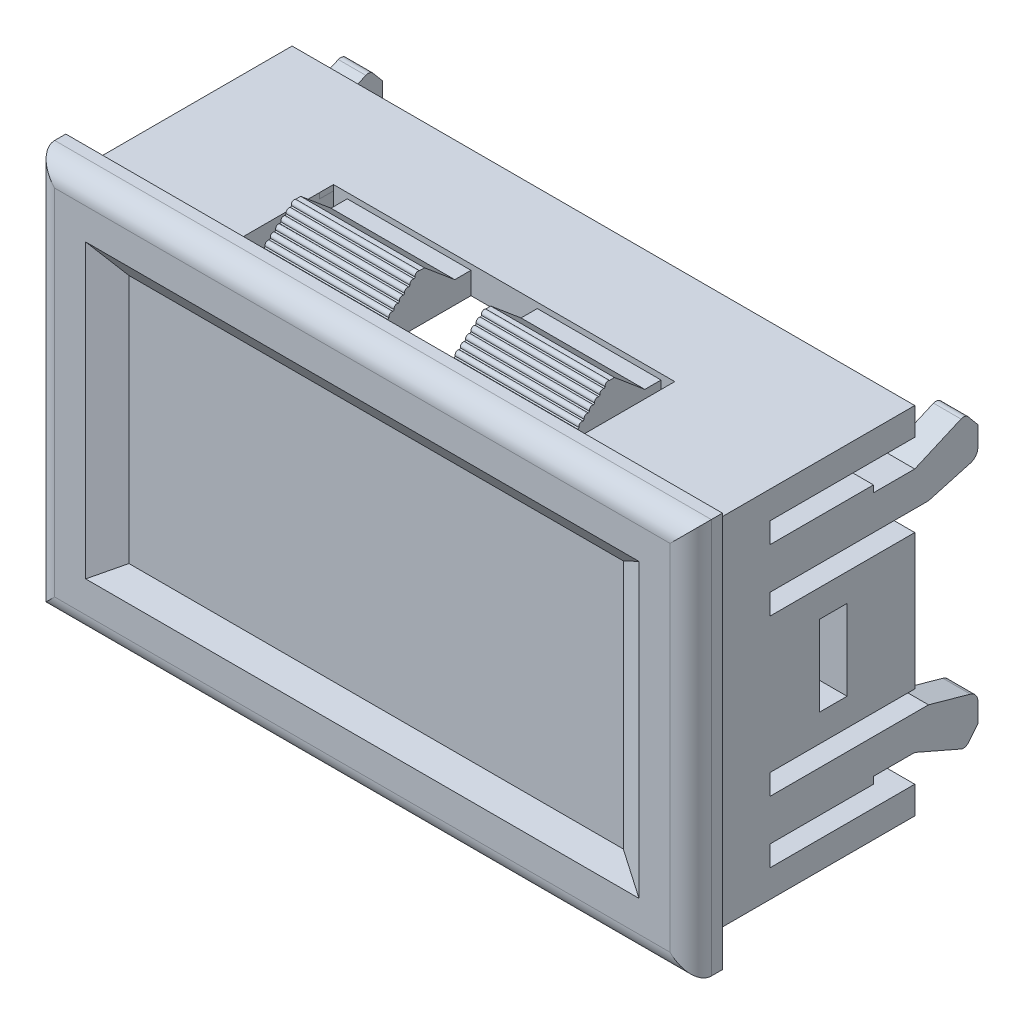
from build123d import *
from OCP.BRepFilletAPI import BRepFilletAPI_MakeChamfer

# Parameters (mm, degrees)
ESBO_O1_W                   = 47.75
ESBO_O1_H                   = 28.75
RESSALTO_EXTRUS_O1_DEPTH    = 17.53
ESBO_O3_W                   = 55.113346814
ESBO_O3_H                   = 32.23245858
ESBO_O3_W_2                 = 45.28
ESBO_O3_H_2                 = 25.85
CORTE_EXTRUS_O1_DEPTH       = 15.22
CORTE_EXTRUS_O2_DEPTH       = 17
CORTE_EXTRUS_O2_DEPTH_BACK  = 33.22
ESBO_O4_W                   = 35.95
ESBO_O4_H                   = 18.14
ESBO_O5_W                   = 41.28
ESBO_O5_H                   = 21.85
CORTE_EXTRUS_O3_DEPTH       = 15.22
CHANFRO1_SIZE               = 1
CHANFRO1_SIZE2              = 2.144506921
CHANFRO2_SIZE               = 1
CHANFRO2_SIZE2              = 2.144506921
CHANFRO3_SIZE               = 1
CHANFRO3_SIZE2              = 1.539864964
FILETE1_R                   = 1.5
CORTE_EXTRUS_O4_DEPTH       = 15
CORTE_EXTRUS_O4_DEPTH_BACK  = 44.22
CORTE_EXTRUS_O5_DEPTH       = 0.4
ESBO_O8_W                   = 24.82
ESBO_O8_H                   = 1
CORTE_EXTRUS_O6_DEPTH       = 0.4
ESBO_O9_W                   = 9
ESBO_O9_H                   = 6.324480946
RESSALTO_EXTRUS_O2_DEPTH    = 1.45
ESBO_O10_W                  = 9
ESBO_O10_H                  = 6.324480946
RESSALTO_EXTRUS_O3_DEPTH    = 1.45
ESBO_O11_W                  = 9
ESBO_O11_H                  = 6.324480946
RESSALTO_EXTRUS_O4_DEPTH    = 1.45
CHANFRO4_SIZE               = 3
CHANFRO4_SIZE2              = 3.575260778
RESSALTO_EXTRUS_O5_DEPTH    = 22.82
CORTE_EXTRUS_O9_DEPTH       = 16
CORTE_EXTRUS_O9_DEPTH_BACK  = 35.82
ESBO_O15_W                  = 4.82
ESBO_O15_H                  = 3.575260778
CORTE_EXTRUS_O10_DEPTH      = 22.82
RESSALTO_EXTRUS_O6_DEPTH    = 9
RESSALTO_EXTRUS_O8_DEPTH    = 9
RESSALTO_EXTRUS_O9_DEPTH    = 22.82
ESBO_O21_W                  = 4.82
ESBO_O21_H                  = 3.736219412
CORTE_EXTRUS_O11_DEPTH      = 22.82
CORTE_EXTRUS_O13_DEPTH      = 20
CORTE_EXTRUS_O13_DEPTH_BACK = 22.82
ESBO_O22_W                  = 4.82
ESBO_O22_H                  = 3.575260778
ESBO_O23_W                  = 2
ESBO_O23_H                  = 5.85
ESBO_O23_W_2                = 10.53
ESBO_O23_H_2                = 1.5
CORTE_EXTRUS_O14_DEPTH      = 62.82
ESBO_O24_W                  = 3
ESBO_O24_H                  = 0.495952345
ESBO_O24_H_2                = 0.5
CORTE_EXTRUS_O15_DEPTH      = 62.82
RESSALTO_EXTRUS_O10_DEPTH   = 45.28
ESBO_O26_W                  = 41.28
ESBO_O26_H                  = 21.85
CORTE_EXTRUS_O16_DEPTH      = 41.28
SKETCH1_W                   = 1.31
SKETCH1_H                   = 18.14
BOSS_EXTRUDE1_DEPTH         = 35.95


with BuildPart() as part:
    # Esboço1 → Ressalto-extrusão1 (new body)
    with BuildSketch(Plane.XY):
        Rectangle(ESBO_O1_W, ESBO_O1_H)
    extrude(amount=RESSALTO_EXTRUS_O1_DEPTH)

    # Esboço3 → Corte-extrusão1 (cut)
    with BuildSketch(Plane(origin=(0, 0, 0), x_dir=(-1, 0, 0), z_dir=(0, 0, -1))):
        Rectangle(ESBO_O3_W, ESBO_O3_H)
        Rectangle(ESBO_O3_W_2, ESBO_O3_H_2, mode=Mode.SUBTRACT)
    extrude(amount=-CORTE_EXTRUS_O1_DEPTH, mode=Mode.SUBTRACT)

    # Esboço4 → Corte-extrusão2 (cut, two sides: drawn at the far end of the back side and taken through both)
    with BuildSketch(Plane.XY.offset(17.53).offset(-CORTE_EXTRUS_O2_DEPTH_BACK)):
        Rectangle(ESBO_O4_W, ESBO_O4_H)
    extrude(amount=CORTE_EXTRUS_O2_DEPTH + CORTE_EXTRUS_O2_DEPTH_BACK, mode=Mode.SUBTRACT)

    # Esboço5 → Corte-extrusão3 (cut)
    with BuildSketch(Plane(origin=(0, 0, 0), x_dir=(-1, 0, 0), z_dir=(0, 0, -1))):
        Rectangle(ESBO_O5_W, ESBO_O5_H)
    extrude(amount=-CORTE_EXTRUS_O3_DEPTH, mode=Mode.SUBTRACT)

    # Chanfro1
    chanfro1_edges = [part.edges().sort_by_distance(p)[0] for p in [
        (17.975, 0, 17.53),
    ]]
    chanfro1_side = [part.faces().sort_by_distance(p)[0] for p in [
        (17.975, 0, 16.375),
    ]]
    chamfer(chanfro1_edges, length=CHANFRO1_SIZE, length2=CHANFRO1_SIZE2, reference=chanfro1_side[0])

    # Chanfro2
    chanfro2_edges = [part.edges().sort_by_distance(p)[0] for p in [
        (-17.975, 0, 17.53),
    ]]
    chanfro2_side = [part.faces().sort_by_distance(p)[0] for p in [
        (-17.975, 0, 16.375),
    ]]
    chamfer(chanfro2_edges, length=CHANFRO2_SIZE, length2=CHANFRO2_SIZE2, reference=chanfro2_side[0])

    # Chanfro3: one chamfer whose edges measure the first distance from different faces: ONE call of the kernel's chamfer builder (chamfer() names one face for all edges)
    chanfro3_edges_1 = [part.edges().sort_by_distance(p)[0] for p in [
        (0, -9.07, 17.53),
    ]]
    chanfro3_side_1 = [part.faces().sort_by_distance(p)[0] for p in [
        (0, -9.07, 16.39568424),
    ]]
    chanfro3_edges_2 = [part.edges().sort_by_distance(p)[0] for p in [
        (0, 9.07, 17.53),
    ]]
    chanfro3_side_2 = [part.faces().sort_by_distance(p)[0] for p in [
        (0, 9.07, 16.39568424),
    ]]
    chanfro3 = BRepFilletAPI_MakeChamfer(part.part.solid().wrapped)
    for e in chanfro3_edges_1:
        chanfro3.Add(CHANFRO3_SIZE, CHANFRO3_SIZE2, e.wrapped, chanfro3_side_1[0].wrapped)  # the first distance lies on this face
    for e in chanfro3_edges_2:
        chanfro3.Add(CHANFRO3_SIZE, CHANFRO3_SIZE2, e.wrapped, chanfro3_side_2[0].wrapped)  # the first distance lies on this face
    add(Compound.cast(chanfro3.Shape()), mode=Mode.REPLACE)

    # Filete1
    filete1_edges = [part.edges().sort_by_distance(p)[0] for p in [
        (23.875, 0, 17.53),
        (0, 14.375, 17.53),
        (-23.875, 0, 17.53),
        (0, -14.375, 17.53),
    ]]
    fillet(filete1_edges, radius=FILETE1_R)

    # Esboço6 → Corte-extrusão4 (cut, two sides: drawn at the far end of the back side and taken through both)
    with BuildSketch(Plane(origin=(0, 12.925, 0), x_dir=(1, 0, 0), z_dir=(0, 1, 0)).offset(-CORTE_EXTRUS_O4_DEPTH_BACK)):
        Polygon((-11.41, -7.895519054), (-11.41, -7.22), (-12.41, -7.22), (-12.41, -15.22), (12.41, -15.22), (12.41, -7.22), (11.41, -7.22), (11.41, -7.895519054), (11.41, -14.544480946), (2.41, -14.544480946), (2.41, -7.22), (-2.41, -7.22), (-2.41, -14.544480946), (-11.41, -14.544480946), align=None)
    extrude(amount=CORTE_EXTRUS_O4_DEPTH + CORTE_EXTRUS_O4_DEPTH_BACK, mode=Mode.SUBTRACT)

    # Esboço7 → Corte-extrusão5 (cut)
    with BuildSketch(Plane(origin=(0, 12.925, 0), x_dir=(1, 0, 0), z_dir=(0, 1, 0))):
        Polygon((-12.410087555, -8.22), (12.410087555, -8.22), (12.41, -7.22), (-12.41, -7.22), align=None)
    extrude(amount=-CORTE_EXTRUS_O5_DEPTH, mode=Mode.SUBTRACT)

    # Esboço8 → Corte-extrusão6 (cut)
    with BuildSketch(Plane.XZ.offset(12.925)):
        with Locations((0, 7.72)):
            Rectangle(ESBO_O8_W, ESBO_O8_H)
    extrude(amount=-CORTE_EXTRUS_O6_DEPTH, mode=Mode.SUBTRACT)

    # Esboço9 → Ressalto-extrusão2 (add)
    with BuildSketch(Plane(origin=(0, 12.925, 0), x_dir=(1, 0, 0), z_dir=(0, 1, 0))):
        with Locations((-6.91, -11.382240473)):
            Rectangle(ESBO_O9_W, ESBO_O9_H)
    extrude(amount=RESSALTO_EXTRUS_O2_DEPTH)

    # Esboço10 → Ressalto-extrusão3 (add)
    with BuildSketch(Plane(origin=(0, 12.925, 0), x_dir=(1, 0, 0), z_dir=(0, 1, 0))):
        with Locations((6.91, -11.382240473)):
            Rectangle(ESBO_O10_W, ESBO_O10_H)
    extrude(amount=RESSALTO_EXTRUS_O3_DEPTH)

    # Esboço11 → Ressalto-extrusão4 (add)
    with BuildSketch(Plane.XZ.offset(12.925)):
        with Locations((6.91, 11.382240473)):
            Rectangle(ESBO_O11_W, ESBO_O11_H)
        Polygon((-2.41, 8.22), (-2.41, 14.544480946), (-6.91, 14.544480946), (-11.41, 14.544480946), (-11.41, 8.22), align=None)
    extrude(amount=RESSALTO_EXTRUS_O4_DEPTH)

    # Chanfro4: one chamfer whose edges measure the first distance from different faces: ONE call of the kernel's chamfer builder (chamfer() names one face for all edges)
    chanfro4_edges_1 = [part.edges().sort_by_distance(p)[0] for p in [
        (-6.91, 14.375, 14.544480946),
    ]]
    chanfro4_side_1 = [part.faces().sort_by_distance(p)[0] for p in [
        (-6.91, 12.65, 14.544480946),
    ]]
    chanfro4_edges_2 = [part.edges().sort_by_distance(p)[0] for p in [
        (6.91, 14.375, 14.544480946),
    ]]
    chanfro4_side_2 = [part.faces().sort_by_distance(p)[0] for p in [
        (6.91, 12.65, 14.544480946),
    ]]
    chanfro4_edges_3 = [part.edges().sort_by_distance(p)[0] for p in [
        (6.91, -14.375, 14.544480946),
    ]]
    chanfro4_side_3 = [part.faces().sort_by_distance(p)[0] for p in [
        (6.91, -12.65, 14.544480946),
    ]]
    chanfro4_edges_4 = [part.edges().sort_by_distance(p)[0] for p in [
        (-6.91, -14.375, 14.544480946),
    ]]
    chanfro4_side_4 = [part.faces().sort_by_distance(p)[0] for p in [
        (-6.91, -12.65, 14.544480946),
    ]]
    chanfro4 = BRepFilletAPI_MakeChamfer(part.part.solid().wrapped)
    for e in chanfro4_edges_1:
        chanfro4.Add(CHANFRO4_SIZE, CHANFRO4_SIZE2, e.wrapped, chanfro4_side_1[0].wrapped)  # the first distance lies on this face
    for e in chanfro4_edges_2:
        chanfro4.Add(CHANFRO4_SIZE, CHANFRO4_SIZE2, e.wrapped, chanfro4_side_2[0].wrapped)  # the first distance lies on this face
    for e in chanfro4_edges_3:
        chanfro4.Add(CHANFRO4_SIZE, CHANFRO4_SIZE2, e.wrapped, chanfro4_side_3[0].wrapped)  # the first distance lies on this face
    for e in chanfro4_edges_4:
        chanfro4.Add(CHANFRO4_SIZE, CHANFRO4_SIZE2, e.wrapped, chanfro4_side_4[0].wrapped)  # the first distance lies on this face
    add(Compound.cast(chanfro4.Shape()), mode=Mode.REPLACE)

    # Chanfro5
    # the kernel refuses this chamfer: 2.383507185, 2 mm, written as the material it takes off along each edge
    with BuildSketch(Plane(origin=(-11.41, 14.375, 8.22), x_dir=(0, 0.024939322090234445, 0.9996889667359941), z_dir=(1, 0, 0))) as chanfro5_piece_1_section:
        with BuildLine():
            Line((2.457306387, 0), (-0.124419196, 2.058820987))
            Line((-0.124419196, 2.058820987), (-0.172074512, 2.057632126))
            ThreePointArc((-0.172074512, 2.057632126), (-0.073358824, 1.029132353), (-0.047655317, -0.001188861))
            Line((-0.047655317, -0.001188861), (0.001188861, -0.047655317))
            ThreePointArc((0.001188861, -0.047655317), (1.229077869, -0.01702307), (2.458495248, -0.047655317))
            Line((2.458495248, -0.047655317), (2.457306387, 0))
        make_face()
    chanfro5_piece_1 = extrude(amount=9, mode=Mode.PRIVATE)
    chanfro5_piece_1 = split(chanfro5_piece_1, bisect_by=Plane(origin=(-6.91, 12.525, 9.020332746), z_dir=(0, 1, 0)), keep=Keep.TOP, mode=Mode.PRIVATE)
    add(chanfro5_piece_1, mode=Mode.SUBTRACT)
    with BuildSketch(Plane(origin=(11.41, 14.375, 8.22), x_dir=(0, 0.024939322090234445, 0.9996889667359941), z_dir=(-1, 0, 0))) as chanfro5_piece_2_section:
        with BuildLine():
            Line((2.457306387, 0), (-0.124419196, -2.058820987))
            Line((-0.124419196, -2.058820987), (-0.172074512, -2.057632126))
            ThreePointArc((-0.172074512, -2.057632126), (-0.073358824, -1.029132353), (-0.047655317, 0.001188861))
            Line((-0.047655317, 0.001188861), (0.001188861, 0.047655317))
            ThreePointArc((0.001188861, 0.047655317), (1.229077869, 0.01702307), (2.458495248, 0.047655317))
            Line((2.458495248, 0.047655317), (2.457306387, 0))
        make_face()
    chanfro5_piece_2 = extrude(amount=9, mode=Mode.PRIVATE)
    chanfro5_piece_2 = split(chanfro5_piece_2, bisect_by=Plane(origin=(6.91, 12.525, 9.020332746), z_dir=(0, 1, 0)), keep=Keep.TOP, mode=Mode.PRIVATE)
    add(chanfro5_piece_2, mode=Mode.SUBTRACT)
    with BuildSketch(Plane(origin=(2.41, -14.375, 8.22), x_dir=(0, -0.024939322090234445, 0.9996889667359941), z_dir=(1, 0, 0))) as chanfro5_piece_3_section:
        with BuildLine():
            Line((2.457306387, 0), (-0.124419196, -2.058820987))
            Line((-0.124419196, -2.058820987), (-0.172074512, -2.057632126))
            ThreePointArc((-0.172074512, -2.057632126), (-0.073358824, -1.029132353), (-0.047655317, 0.001188861))
            Line((-0.047655317, 0.001188861), (0.001188861, 0.047655317))
            ThreePointArc((0.001188861, 0.047655317), (1.229077869, 0.01702307), (2.458495248, 0.047655317))
            Line((2.458495248, 0.047655317), (2.457306387, 0))
        make_face()
    chanfro5_piece_3 = extrude(amount=9, mode=Mode.PRIVATE)
    chanfro5_piece_3 = split(chanfro5_piece_3, bisect_by=Plane(origin=(6.91, -12.525, 9.020332746), z_dir=(0, -1, 0)), keep=Keep.TOP, mode=Mode.PRIVATE)
    add(chanfro5_piece_3, mode=Mode.SUBTRACT)
    with BuildSketch(Plane(origin=(-11.41, -14.375, 8.22), x_dir=(0, -0.03540953691366296, 0.9993728857116145), z_dir=(1, 0, 0))) as chanfro5_piece_4_section:
        with BuildLine():
            Line((2.062577027, 0), (-0.148230141, -2.452831528))
            Line((-0.148230141, -2.452831528), (-0.19587039, -2.45114355))
            ThreePointArc((-0.19587039, -2.45114355), (-0.091132758, -1.225812797), (-0.047640249, 0.001687978))
            Line((-0.047640249, 0.001687978), (0.001687978, 0.047640249))
            ThreePointArc((0.001687978, 0.047640249), (1.031683425, 0.011145701), (2.064265005, 0.047640249))
            Line((2.064265005, 0.047640249), (2.062577027, 0))
        make_face()
    chanfro5_piece_4 = extrude(amount=9, mode=Mode.PRIVATE)
    chanfro5_piece_4 = split(chanfro5_piece_4, bisect_by=Plane(origin=(-6.91, -12.525, 8.913974099), z_dir=(0, -1, 0)), keep=Keep.TOP, mode=Mode.PRIVATE)
    add(chanfro5_piece_4, mode=Mode.SUBTRACT)

    # Esboço13 → Ressalto-extrusão5 (add)
    with BuildSketch(Plane.ZY.offset(11.41)):
        with BuildLine():
            Line((11.273544974, 14.119641167), (10.969220168, 14.375))
            ThreePointArc((10.969220168, 14.375), (11.208122757, 14.350693512), (11.273544974, 14.119641167))
        make_face()
        with BuildLine():
            Line((11.352242389, 14.053606195), (11.656567196, 13.798247362))
            ThreePointArc((11.656567196, 13.798247362), (11.591144979, 14.029299707), (11.352242389, 14.053606195))
        make_face()
        with BuildLine():
            Line((11.735264611, 13.73221239), (12.039589418, 13.476853557))
            ThreePointArc((12.039589418, 13.476853557), (11.974167201, 13.707905902), (11.735264611, 13.73221239))
        make_face()
        with BuildLine():
            Line((12.118286833, 13.410818585), (12.422611639, 13.155459753))
            ThreePointArc((12.422611639, 13.155459753), (12.357189422, 13.386512098), (12.118286833, 13.410818585))
        make_face()
        with BuildLine():
            Line((12.501309054, 13.089424781), (12.805633861, 12.834065948))
            ThreePointArc((12.805633861, 12.834065948), (12.740211644, 13.065118293), (12.501309054, 13.089424781))
        make_face()
        with BuildLine():
            Line((12.884331276, 12.768030976), (13.188656082, 12.512672143))
            ThreePointArc((13.188656082, 12.512672143), (13.123233865, 12.743724488), (12.884331276, 12.768030976))
        make_face()
        with BuildLine():
            Line((13.267353497, 12.446637171), (13.571678304, 12.191278338))
            ThreePointArc((13.571678304, 12.191278338), (13.506256087, 12.422330683), (13.267353497, 12.446637171))
        make_face()
        with BuildLine():
            Line((13.650375719, 12.125243366), (13.954700525, 11.869884533))
            ThreePointArc((13.954700525, 11.869884533), (13.889278308, 12.100936878), (13.650375719, 12.125243366))
        make_face()
        with BuildLine():
            Line((14.03339794, 11.803849561), (14.337722747, 11.548490728))
            ThreePointArc((14.337722747, 11.548490728), (14.27230053, 11.779543073), (14.03339794, 11.803849561))
        make_face()
    extrude(amount=-RESSALTO_EXTRUS_O5_DEPTH)

    # Esboço15 → Corte-extrusão9 (cut, two sides: drawn at the far end of the back side and taken through both)
    with BuildSketch(Plane.XZ.offset(12.925).offset(-CORTE_EXTRUS_O9_DEPTH_BACK)):
        with Locations((0, 12.756850557)):
            Rectangle(ESBO_O15_W, ESBO_O15_H)
    extrude(amount=CORTE_EXTRUS_O9_DEPTH + CORTE_EXTRUS_O9_DEPTH_BACK, mode=Mode.SUBTRACT)

    # Esboço16 → Corte-extrusão10 (cut)
    with BuildSketch(Plane(origin=(11.41, 0, 0), x_dir=(0, 0, -1), z_dir=(1, 0, 0))):
        Polygon((-10.603507185, -14.375), (-8.884466348, -12.932553467), (-8.724064542, -13.158224113), (-10.132393394, -14.768426279), align=None)
    extrude(amount=-CORTE_EXTRUS_O10_DEPTH, mode=Mode.SUBTRACT)

    # Esboço18 → Ressalto-extrusão6 (add)
    with BuildSketch(Plane(origin=(11.41, 0, 0), x_dir=(0, 0, -1), z_dir=(1, 0, 0))):
        Polygon((-8.398763039, -12.525), (-10.603507185, -14.375), (-10.98861429, -13.916047224), (-8.744858794, -12.033312815), align=None)
    extrude(amount=-RESSALTO_EXTRUS_O6_DEPTH)

    # Esboço19 → Ressalto-extrusão8 (add)
    with BuildSketch(Plane.ZY.offset(11.41)):
        Polygon((8.398763039, -12.525), (10.603507185, -14.375), (10.687276473, -14.27516765), (8.703640565, -12.471286403), align=None)
    extrude(amount=-RESSALTO_EXTRUS_O8_DEPTH)

    # Esboço20 → Ressalto-extrusão9 (add)
    with BuildSketch(Plane(origin=(11.41, 0, 0), x_dir=(0, 0, -1), z_dir=(1, 0, 0))):
        with BuildLine():
            Line((-10.969220168, -14.375), (-11.290958834, -14.105029204))
            ThreePointArc((-11.290958834, -14.105029204), (-11.243148352, -14.374752894), (-10.969220168, -14.375))
        make_face()
        with BuildLine():
            Line((-11.352242389, -14.053606195), (-11.673981056, -13.783635399))
            ThreePointArc((-11.673981056, -13.783635399), (-11.626170574, -14.053359089), (-11.352242389, -14.053606195))
        make_face()
        with BuildLine():
            Line((-11.735264611, -13.73221239), (-12.057003277, -13.462241594))
            ThreePointArc((-12.057003277, -13.462241594), (-12.009192795, -13.731965284), (-11.735264611, -13.73221239))
        make_face()
        with BuildLine():
            Line((-12.118286833, -13.410818585), (-12.440025499, -13.140847789))
            ThreePointArc((-12.440025499, -13.140847789), (-12.392215017, -13.41057148), (-12.118286833, -13.410818585))
        make_face()
        with BuildLine():
            Line((-12.501309054, -13.089424781), (-12.82304772, -12.819453985))
            ThreePointArc((-12.82304772, -12.819453985), (-12.775237238, -13.089177675), (-12.501309054, -13.089424781))
        make_face()
        with BuildLine():
            Line((-12.884331276, -12.768030976), (-13.206069942, -12.49806018))
            ThreePointArc((-13.206069942, -12.49806018), (-13.15825946, -12.76778387), (-12.884331276, -12.768030976))
        make_face()
        with BuildLine():
            Line((-13.267353497, -12.446637171), (-13.589092163, -12.176666375))
            ThreePointArc((-13.589092163, -12.176666375), (-13.541281681, -12.446390065), (-13.267353497, -12.446637171))
        make_face()
        with BuildLine():
            Line((-13.650375719, -12.125243366), (-13.972114385, -11.85527257))
            ThreePointArc((-13.972114385, -11.85527257), (-13.924303903, -12.12499626), (-13.650375719, -12.125243366))
        make_face()
        with BuildLine():
            Line((-14.03339794, -11.803849561), (-14.355136606, -11.533878765))
            ThreePointArc((-14.355136606, -11.533878765), (-14.307326125, -11.803602455), (-14.03339794, -11.803849561))
        make_face()
    extrude(amount=-RESSALTO_EXTRUS_O9_DEPTH)

    # Esboço21 → Corte-extrusão11 (cut)
    with BuildSketch(Plane.XZ.offset(12.925)):
        with Locations((0, 12.67637124)):
            Rectangle(ESBO_O21_W, ESBO_O21_H)
    extrude(amount=-CORTE_EXTRUS_O11_DEPTH, mode=Mode.SUBTRACT)

    # Esboço22 → Corte-extrusão13 (cut, two sides: drawn at the far end of the back side and taken through both)
    with BuildSketch(Plane.XZ.offset(12.925).offset(-CORTE_EXTRUS_O13_DEPTH_BACK)):
        with Locations((0, 12.756850557)):
            Rectangle(ESBO_O22_W, ESBO_O22_H)
    extrude(amount=CORTE_EXTRUS_O13_DEPTH + CORTE_EXTRUS_O13_DEPTH_BACK, mode=Mode.SUBTRACT)

    # Esboço23 → Corte-extrusão14 (cut)
    with BuildSketch(Plane(origin=(22.64, 0, 0), x_dir=(0, 0, -1), z_dir=(1, 0, 0))):
        with Locations((-5.92, 0)):
            Rectangle(ESBO_O23_W, ESBO_O23_H)
        with Locations((-5.265, -10.175)):
            Rectangle(ESBO_O23_W_2, ESBO_O23_H_2)
        with Locations((-5.265, -5.675)):
            Rectangle(ESBO_O23_W_2, ESBO_O23_H_2)
        with Locations((-5.265, 10.175)):
            Rectangle(ESBO_O23_W_2, ESBO_O23_H_2)
        with Locations((-5.265, 5.675)):
            Rectangle(ESBO_O23_W_2, ESBO_O23_H_2)
    extrude(amount=-CORTE_EXTRUS_O14_DEPTH, mode=Mode.SUBTRACT)

    # Esboço24 → Corte-extrusão15 (cut)
    with BuildSketch(Plane(origin=(22.64, 0, 0), x_dir=(0, 0, -1), z_dir=(1, 0, 0))):
        with Locations((-1.5, 9.177023828)):
            Rectangle(ESBO_O24_W, ESBO_O24_H)
        with Locations((-1.5, -9.175)):
            Rectangle(ESBO_O24_W, ESBO_O24_H_2)
    extrude(amount=-CORTE_EXTRUS_O15_DEPTH, mode=Mode.SUBTRACT)

    # Esboço25 → Ressalto-extrusão10 (add)
    with BuildSketch(Plane(origin=(22.64, 0, 0), x_dir=(0, 0, -1), z_dir=(1, 0, 0))):
        with BuildLine():
            Line((3.888830988, 10.266988264), (4.59, 9.425))
            Line((4.59, 9.425), (4.59, 7.99463944))
            ThreePointArc((4.59, 7.99463944), (4.437259941, 7.541009015), (4.041251834, 7.272145358))
            Line((4.041251834, 7.272145358), (1, 6.425))
            Line((1, 6.425), (0, 6.425))
            Line((0, 6.425), (0, 8.929047655))
            Line((0, 8.929047655), (3.363583445, 10.391695207))
            ThreePointArc((3.363583445, 10.391695207), (3.646984436, 10.416852371), (3.888830988, 10.266988264))
        make_face()
        with BuildLine():
            ThreePointArc((3.889298644, -10.266178705), (3.647299798, -10.416038716), (3.363786952, -10.390702375))
            Line((3.363786952, -10.390702375), (0, -8.925))
            Line((0, -8.925), (0, -6.425))
            Line((0, -6.425), (1, -6.425))
            Line((1, -6.425), (4.041251834, -7.272145358))
            ThreePointArc((4.041251834, -7.272145358), (4.437259941, -7.541009015), (4.59, -7.99463944))
            Line((4.59, -7.99463944), (4.59, -9.425))
            Line((4.59, -9.425), (3.889298644, -10.266178705))
        make_face()
    extrude(amount=-RESSALTO_EXTRUS_O10_DEPTH)

    # Esboço26 → Corte-extrusão16 (cut)
    with BuildSketch(Plane(origin=(0, 0, 15.22), x_dir=(-1, 0, 0), z_dir=(0, 0, -1))):
        Rectangle(ESBO_O26_W, ESBO_O26_H)
    extrude(amount=CORTE_EXTRUS_O16_DEPTH, mode=Mode.SUBTRACT)

    # Sketch1 → Boss-Extrude1 (add)
    with BuildSketch(Plane(origin=(-17.975, 0, 0), x_dir=(0, 0, -1), z_dir=(1, 0, 0))):
        with Locations((-15.875, 0)):
            Rectangle(SKETCH1_W, SKETCH1_H)
    extrude(amount=BOSS_EXTRUDE1_DEPTH)


solid = part.part
